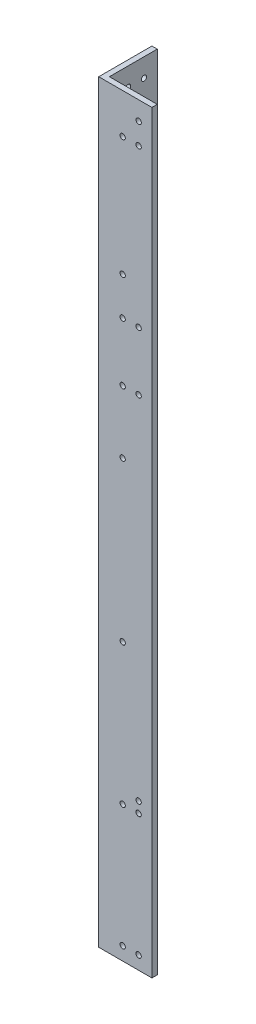
from build123d import *

# Parameters (mm, degrees)
BOSS_EXTRUDE1_DEPTH               = 450
RIGHTSIDEHOLES_SKETCH3_R          = 1.5875
RIGHTSIDEHOLES_CUT_EXTRUDE1_DEPTH = 3.175
FRONTSIDEHOLES_SKETCH4_R          = 1.5875
FRONTSIDEHOLES_SKETCH4_R_2        = 2
FRONTSIDEHOLES_CUT_EXTRUDE2_DEPTH = 3.175


with BuildPart() as part:
    # Sketch2 → Boss-Extrude1 (new body)
    with BuildSketch(Plane(origin=(0, 0, 0), x_dir=(1, 0, 0), z_dir=(0, 1, 0))):
        Polygon((0, 31.75), (3.175, 31.75), (3.175, 3.175), (31.75, 3.175), (31.75, 0), (0, 0), align=None)
    extrude(amount=BOSS_EXTRUDE1_DEPTH)

    # RightSideHoles-Sketch3 → RightSideHoles-Cut-Extrude1 (cut)
    with BuildSketch(Plane.XY):
        with Locations((14.2875, 81.1125)):
            Circle(RIGHTSIDEHOLES_SKETCH3_R)
        with Locations((23.8125, 81.1125)):
            Circle(RIGHTSIDEHOLES_SKETCH3_R)
        with Locations((23.8125, 87.4625)):
            Circle(RIGHTSIDEHOLES_SKETCH3_R)
        with Locations((14.2875, 426.1875)):
            Circle(RIGHTSIDEHOLES_SKETCH3_R)
        with Locations((23.8125, 438.8875)):
            Circle(RIGHTSIDEHOLES_SKETCH3_R)
        with Locations((23.8125, 426.1875)):
            Circle(RIGHTSIDEHOLES_SKETCH3_R)
        with Locations((14.2875, 332.377644)):
            Circle(RIGHTSIDEHOLES_SKETCH3_R)
        with Locations((23.8125, 332.377644)):
            Circle(RIGHTSIDEHOLES_SKETCH3_R)
        with Locations((14.2875, 297.452644)):
            Circle(RIGHTSIDEHOLES_SKETCH3_R)
        with Locations((23.8125, 297.452644)):
            Circle(RIGHTSIDEHOLES_SKETCH3_R)
        with Locations((14.2875, 7.9375)):
            Circle(RIGHTSIDEHOLES_SKETCH3_R)
        with Locations((23.8125, 7.9375)):
            Circle(RIGHTSIDEHOLES_SKETCH3_R)
        with Locations((14.2875, 165)):
            Circle(RIGHTSIDEHOLES_SKETCH3_R)
        with Locations((14.2875, 260)):
            Circle(RIGHTSIDEHOLES_SKETCH3_R)
        with Locations((14.2875, 355)):
            Circle(RIGHTSIDEHOLES_SKETCH3_R)
    extrude(amount=-RIGHTSIDEHOLES_CUT_EXTRUDE1_DEPTH, mode=Mode.SUBTRACT)

    # FrontSideHoles-Sketch4 → FrontSideHoles-Cut-Extrude2 (cut)
    with BuildSketch(Plane.ZY):
        with Locations((-23.8125, 81.1125)):
            Circle(FRONTSIDEHOLES_SKETCH4_R)
        with Locations((-23.8125, 87.4625)):
            Circle(FRONTSIDEHOLES_SKETCH4_R)
        with Locations((-14.2875, 87.4625)):
            Circle(FRONTSIDEHOLES_SKETCH4_R)
        with Locations((-23.8125, 438.8875)):
            Circle(FRONTSIDEHOLES_SKETCH4_R)
        with Locations((-14.2875, 438.8875)):
            Circle(FRONTSIDEHOLES_SKETCH4_R)
        with Locations((-23.8125, 426.1875)):
            Circle(FRONTSIDEHOLES_SKETCH4_R)
        with Locations((-14.2875, 350.015144)):
            Circle(FRONTSIDEHOLES_SKETCH4_R_2)
        with Locations((-14.2875, 309.815144)):
            Circle(FRONTSIDEHOLES_SKETCH4_R_2)
        with Locations((-14.2875, 165)):
            Circle(FRONTSIDEHOLES_SKETCH4_R)
        with Locations((-14.2875, 260)):
            Circle(FRONTSIDEHOLES_SKETCH4_R)
        with Locations((-23.8125, 7.9375)):
            Circle(FRONTSIDEHOLES_SKETCH4_R)
        with Locations((-14.2875, 7.9375)):
            Circle(FRONTSIDEHOLES_SKETCH4_R)
    extrude(amount=-FRONTSIDEHOLES_CUT_EXTRUDE2_DEPTH, mode=Mode.SUBTRACT)


solid = part.part
